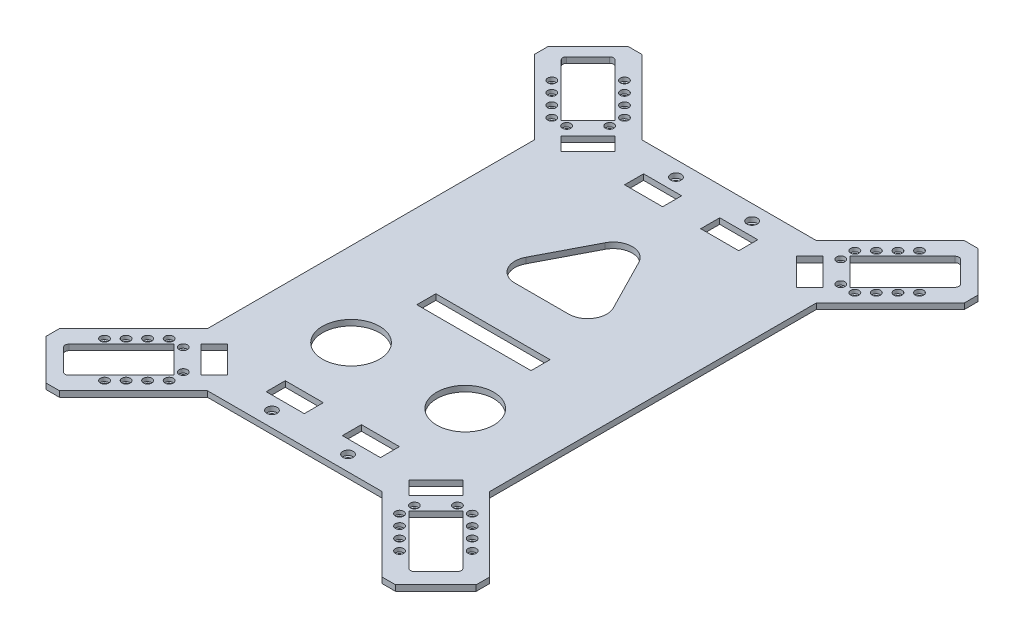
from build123d import *

# Parameters (mm, degrees)
BOSS_EXTRUDE1_DEPTH              = 3
CUT_EXTRUDE1_DEPTH               = 10
CUT_EXTRUDE2_DEPTH               = 10
CBORE_FOR_M2_SHCS1_D             = 2.4
CBORE_FOR_M2_SHCS1_CBORE_D       = 4.4
CBORE_FOR_M2_SHCS1_CBORE_DEPTH   = 2
MIRROR2_COPY_1_D                 = 2.4
MIRROR2_COPY_1_CBORE_D           = 4.4
MIRROR2_COPY_1_CBORE_DEPTH       = 2
SKETCH8_W                        = 20
SKETCH8_H                        = 10
SKETCH8_W_2                      = 60
SKETCH8_W_3                      = 120
SKETCH8_H_2                      = 75
CUT_EXTRUDE3_DEPTH               = 10
CBORE_FOR_M2_5_SHCS1_D           = 2.9
CBORE_FOR_M2_5_SHCS1_CBORE_D     = 5.5
CBORE_FOR_M2_5_SHCS1_CBORE_DEPTH = 2.5
SKETCH12_W                       = 10
SKETCH12_H                       = 20
CUT_EXTRUDE4_DEPTH               = 10
CORTAR_EXTRUIR1_DEPTH            = 64
CORTAR_EXTRUIR1_DEPTH_BACK       = 56
CROQUIS1_W                       = 127.204411498
CROQUIS1_H                       = 60
CORTAR_EXTRUIR2_DEPTH            = 160
CORTAR_EXTRUIR2_DEPTH_BACK       = 117
RECUBRIR8_START                  = -34.766907078
RECUBRIR8_OUTLINE_W              = 40.311288742
RECUBRIR8_OUTLINE_H              = 3
RECUBRIR8_DEPTH                  = 5.766907078
RECUBRIR9_DEPTH                  = 3
RECUBRIR13_DEPTH                 = 3
RECUBRIR15_DEPTH                 = 3
RECUBRIR17_DEPTH                 = 3
RECUBRIR19_DEPTH                 = 3
RECUBRIR23_DEPTH                 = 3
RECUBRIR27_DEPTH                 = 3
CORTAR_EXTRUIR7_DEPTH            = 83
CORTAR_EXTRUIR7_DEPTH_BACK       = 143
CORTAR_EXTRUIR8_DEPTH            = 119
CORTAR_EXTRUIR8_DEPTH_BACK       = 125
CROQUIS6_R                       = 15


with BuildPart() as part:
    # Sketch1 → Boss-Extrude1 (new body)
    with BuildSketch(Plane(origin=(0, 0, 0), x_dir=(1, 0, 0), z_dir=(0, 1, 0))):
        Polygon((-74.142135624, -30), (-74.142135624, -85.857864376), (-113.033008589, -124.748737342), (-113.033008589, -131.819805153), (-91.819805153, -153.033008589), (-84.748737342, -153.033008589), (-45.857864376, -114.142135624), (45.857864376, -114.142135624), (84.748737342, -153.033008589), (91.819805153, -153.033008589), (113.033008589, -131.819805153), (113.033008589, -124.748737342), (74.142135624, -85.857864376), (74.142135624, -30), (90.606601718, -20), (145.606601718, -20), (150.606601718, -15), (150.606601718, 15), (145.606601718, 20), (90.606601718, 20), (74.142135624, 30), (74.142135624, 85.857864376), (113.033008589, 124.748737342), (113.033008589, 131.819805153), (91.819805153, 153.033008589), (84.748737342, 153.033008589), (45.857864376, 114.142135624), (-45.857864376, 114.142135624), (-84.748737342, 153.033008589), (-91.819805153, 153.033008589), (-113.033008589, 131.819805153), (-113.033008589, 124.748737342), (-74.142135624, 85.857864376), (-74.142135624, 30), (-90.606601718, 20), (-145.606601718, 20), (-150.606601718, 15), (-150.606601718, -15), (-145.606601718, -20), (-90.606601718, -20), align=None)
    extrude(amount=BOSS_EXTRUDE1_DEPTH)

    # Sketch2 → Cut-Extrude1 (cut)
    with BuildSketch(Plane(origin=(0, 3, 0), x_dir=(1, 0, 0), z_dir=(0, 1, 0))):
        with BuildLine():
            Line((103.106601718, 10), (128.534564611, 10))
            Line((128.534564611, 10), (142.106601718, 10))
            ThreePointArc((142.106601718, 10), (143.52081528, 9.414213562), (144.106601718, 8))
            Line((144.106601718, 8), (144.106601718, -8))
            ThreePointArc((144.106601718, -8), (143.52081528, -9.414213562), (142.106601718, -10))
            Line((142.106601718, -10), (129.458446123, -10))
            Line((129.458446123, -10), (103.106601718, -10))
            Line((103.106601718, -10), (103.106601718, 10))
        make_face()
        with BuildLine():
            Line((-103.106601718, -10), (-129.458446123, -10))
            Line((-129.458446123, -10), (-142.106601718, -10))
            ThreePointArc((-142.106601718, -10), (-143.52081528, -9.414213562), (-144.106601718, -8))
            Line((-144.106601718, -8), (-144.106601718, 8))
            ThreePointArc((-144.106601718, 8), (-143.52081528, 9.414213562), (-142.106601718, 10))
            Line((-142.106601718, 10), (-128.534564611, 10))
            Line((-128.534564611, 10), (-103.106601718, 10))
            Line((-103.106601718, 10), (-103.106601718, -10))
        make_face()
    extrude(amount=-CUT_EXTRUDE1_DEPTH, mode=Mode.SUBTRACT)

    # Sketch4 → Cut-Extrude2 (cut)
    with BuildSketch(Plane(origin=(0, 3, 0), x_dir=(1, 0, 0), z_dir=(0, 1, 0))):
        with BuildLine():
            Line((-75.909902577, 101.767766953), (-61.767766953, 115.909902577))
            Line((-61.767766953, 115.909902577), (-80.058321582, 134.200457205))
            Line((-80.058321582, 134.200457205), (-89.344931419, 143.487067043))
            ThreePointArc((-89.344931419, 143.487067043), (-90.759144982, 144.072853481), (-92.173358544, 143.487067043))
            Line((-92.173358544, 143.487067043), (-103.487067043, 132.173358544))
            ThreePointArc((-103.487067043, 132.173358544), (-104.072853481, 130.759144982), (-103.487067043, 129.344931419))
            Line((-103.487067043, 129.344931419), (-94.200457205, 120.058321582))
            Line((-94.200457205, 120.058321582), (-75.909902577, 101.767766953))
        make_face()
        with BuildLine():
            Line((94.200457205, 120.058321582), (75.909902577, 101.767766953))
            Line((75.909902577, 101.767766953), (61.767766953, 115.909902577))
            Line((61.767766953, 115.909902577), (80.058321582, 134.200457205))
            Line((80.058321582, 134.200457205), (89.344931419, 143.487067043))
            ThreePointArc((89.344931419, 143.487067043), (90.759144982, 144.072853481), (92.173358544, 143.487067043))
            Line((92.173358544, 143.487067043), (103.487067043, 132.173358544))
            ThreePointArc((103.487067043, 132.173358544), (104.072853481, 130.759144982), (103.487067043, 129.344931419))
            Line((103.487067043, 129.344931419), (94.200457205, 120.058321582))
        make_face()
        with BuildLine():
            Line((75.909902577, -101.767766953), (61.767766953, -115.909902577))
            Line((61.767766953, -115.909902577), (80.058321582, -134.200457205))
            Line((80.058321582, -134.200457205), (87.930717857, -142.072853481))
            ThreePointArc((87.930717857, -142.072853481), (89.344931419, -142.658639918), (90.759144982, -142.072853481))
            Line((90.759144982, -142.072853481), (102.072853481, -130.759144982))
            ThreePointArc((102.072853481, -130.759144982), (102.658639918, -129.344931419), (102.072853481, -127.930717857))
            Line((102.072853481, -127.930717857), (94.200457205, -120.058321582))
            Line((94.200457205, -120.058321582), (75.909902577, -101.767766953))
        make_face()
        with BuildLine():
            Line((-94.200457205, -120.058321582), (-75.909902577, -101.767766953))
            Line((-75.909902577, -101.767766953), (-61.767766953, -115.909902577))
            Line((-61.767766953, -115.909902577), (-80.058321582, -134.200457205))
            Line((-80.058321582, -134.200457205), (-89.344931419, -143.487067043))
            ThreePointArc((-89.344931419, -143.487067043), (-90.759144982, -144.072853481), (-92.173358544, -143.487067043))
            Line((-92.173358544, -143.487067043), (-103.487067043, -132.173358544))
            ThreePointArc((-103.487067043, -132.173358544), (-104.072853481, -130.759144982), (-103.487067043, -129.344931419))
            Line((-103.487067043, -129.344931419), (-94.200457205, -120.058321582))
        make_face()
    extrude(amount=-CUT_EXTRUDE2_DEPTH, mode=Mode.SUBTRACT)

    # CBORE for M2 SHCS1 (through all)
    with Locations(Plane(origin=(0, 3, 0), x_dir=(-1, 0, 0), z_dir=(0, 1, 0))):
        with Locations((-104.856601718, -13.5), (-112.856601718, -13.5), (-120.856601718, -13.5), (-128.856601718, -13.5), (-60.530330086, -119.622213178), (-66.187184335, -125.279067427), (-71.844038585, -130.935921677), (-77.500892834, -136.592775926), (-79.622213178, -100.530330086), (-85.279067427, -106.187184335), (-90.935921677, -111.844038585), (-96.592775926, -117.500892834), (-104.856601718, 13.5), (-112.856601718, 13.5), (-120.856601718, 13.5), (-128.856601718, 13.5), (-60.707106781, -112.02081528), (-72.02081528, -100.707106781), (-99.606601718, -8), (-99.606601718, 8)):
            cbore_for_m2_shcs1 = CounterBoreHole(CBORE_FOR_M2_SHCS1_D / 2, CBORE_FOR_M2_SHCS1_CBORE_D / 2, CBORE_FOR_M2_SHCS1_CBORE_DEPTH)

    # Mirror1: CBORE for M2 SHCS1 across plane
    add(cbore_for_m2_shcs1.mirror(Plane(origin=(0, 0, 0), x_dir=(0, 0, 1), z_dir=(1, 0, 0))), mode=Mode.SUBTRACT)

    # Mirror2: CBORE for M2 SHCS1 across plane
    add(cbore_for_m2_shcs1.mirror(Plane.XY), mode=Mode.SUBTRACT)

    # Mirror2 copy 1 (through all)
    with Locations(Plane(origin=(0, 3, 0), x_dir=(1, 0, 0), z_dir=(0, 1, 0))):
        with Locations((-104.856601718, -13.5), (-112.856601718, -13.5), (-120.856601718, -13.5), (-128.856601718, -13.5), (-60.530330086, -119.622213178), (-66.187184335, -125.279067427), (-71.844038585, -130.935921677), (-77.500892834, -136.592775926), (-79.622213178, -100.530330086), (-85.279067427, -106.187184335), (-90.935921677, -111.844038585), (-96.592775926, -117.500892834), (-104.856601718, 13.5), (-112.856601718, 13.5), (-120.856601718, 13.5), (-128.856601718, 13.5), (-60.707106781, -112.02081528), (-72.02081528, -100.707106781), (-99.606601718, -8), (-99.606601718, 8)):
            CounterBoreHole(MIRROR2_COPY_1_D / 2, MIRROR2_COPY_1_CBORE_D / 2, MIRROR2_COPY_1_CBORE_DEPTH)

    # Sketch8 → Cut-Extrude3 (cut)
    with BuildSketch(Plane(origin=(0, 3, 0), x_dir=(1, 0, 0), z_dir=(0, 1, 0))):
        with Locations((20, -94.142135624)):
            Rectangle(SKETCH8_W, SKETCH8_H)
        with Locations((-20, -94.142135624)):
            Rectangle(SKETCH8_W, SKETCH8_H)
        Polygon((-20, -28.162470747), (-55, -28.162470747), (-60, -33.162470747), (-60, -78.162470747), (-55.430942257, -81.131778417), (-19.569057743, -65.193163077), (-15, -58.162470747), (-15, -33.162470747), align=None)
        with Locations((0, -15)):
            Rectangle(SKETCH8_W_2, SKETCH8_H)
        Polygon((55, -28.162470747), (20, -28.162470747), (15, -33.162470747), (15, -58.162470747), (19.569057743, -65.193163077), (55.430942257, -81.131778417), (60, -78.162470747), (60, -33.162470747), align=None)
        with Locations((0, 37.5)):
            Rectangle(SKETCH8_W_3, SKETCH8_H_2)
        with Locations((20, 94.142135624)):
            Rectangle(SKETCH8_W, SKETCH8_H)
        with Locations((-20, 94.142135624)):
            Rectangle(SKETCH8_W, SKETCH8_H)
    extrude(amount=-CUT_EXTRUDE3_DEPTH, mode=Mode.SUBTRACT)

    # CBORE for M2.5 SHCS1 (through all)
    with Locations(Plane(origin=(0, 3, 0), x_dir=(-1, 0, 0), z_dir=(0, 1, 0))):
        with Locations((20, -106.142135624), (-20, -106.142135624), (20, 106.142135624), (-20, 106.142135624)):
            CounterBoreHole(CBORE_FOR_M2_5_SHCS1_D / 2, CBORE_FOR_M2_5_SHCS1_CBORE_D / 2, CBORE_FOR_M2_5_SHCS1_CBORE_DEPTH)

    # Sketch12 → Cut-Extrude4 (cut)
    with BuildSketch(Plane(origin=(0, 3, 0), x_dir=(1, 0, 0), z_dir=(0, 1, 0))):
        Polygon((54.696699141, -108.838834765), (68.838834765, -94.696699141), (61.767766953, -87.625631329), (47.625631329, -101.767766953), align=None)
        with Locations((-88.106601718, 0)):
            Rectangle(SKETCH12_W, SKETCH12_H)
        with Locations((88.106601718, 0)):
            Rectangle(SKETCH12_W, SKETCH12_H)
        Polygon((-68.838834765, -94.696699141), (-54.696699141, -108.838834765), (-47.625631329, -101.767766953), (-61.767766953, -87.625631329), align=None)
        Polygon((-68.838834765, 94.696699141), (-54.696699141, 108.838834765), (-47.625631329, 101.767766953), (-61.767766953, 87.625631329), align=None)
        Polygon((68.838834765, 94.696699141), (54.696699141, 108.838834765), (47.625631329, 101.767766953), (61.767766953, 87.625631329), align=None)
    extrude(amount=-CUT_EXTRUDE4_DEPTH, mode=Mode.SUBTRACT)

    # Croquis1 → Cortar-Extruir1 (cut, two sides: drawn at the far end of the back side and taken through both)
    with BuildSketch(Plane(origin=(0, 3, 0), x_dir=(-1, 0, 0), z_dir=(0, 1, 0)).offset(-CORTAR_EXTRUIR1_DEPTH_BACK)):
        with Locations((137.744341373, 0)):
            Rectangle(CROQUIS1_W, CROQUIS1_H)
    extrude(amount=CORTAR_EXTRUIR1_DEPTH + CORTAR_EXTRUIR1_DEPTH_BACK, mode=Mode.SUBTRACT)

    # Croquis2 → Cortar-Extruir2 (cut, two sides: drawn at the far end of the back side and taken through both)
    with BuildSketch(Plane(origin=(0, 3, 0), x_dir=(-1, 0, 0), z_dir=(0, 1, 0)).offset(-CORTAR_EXTRUIR2_DEPTH_BACK)):
        Polygon((-74.142135624, 30), (-74.142135624, -30), (-161.977885132, -37.027880566), (-168.471156488, 44.126224275), align=None)
    extrude(amount=CORTAR_EXTRUIR2_DEPTH + CORTAR_EXTRUIR2_DEPTH_BACK, mode=Mode.SUBTRACT)

    # loft from a face of the part (recubrir1)
    loft([part.faces().sort_by_distance((-60, 1.5, -37.5))[0], part.faces().sort_by_distance((60, 1.5, -37.5))[0]])

    # loft from a face of the part (recubrir4)
    loft([part.faces().sort_by_distance((-15, 1.5, 45.662470747))[0], part.faces().sort_by_distance((-60, 1.5, 55.662470747))[0]])

    # loft from a face of the part (recubrir5)
    loft([part.faces().sort_by_distance((60, 1.5, 55.662470747))[0], part.faces().sort_by_distance((15, 1.5, 45.662470747))[0]])

    # Recubrir8: read off the stored shape, not the designer's step
    # Recubrir8 outline → Recubrir8 (add)
    with BuildSketch(Plane(origin=(0, 0, 0), x_dir=(0.9922778767136677, 0, 0.12403473458920797), z_dir=(0.12403473458920797, 0, -0.9922778767136677)).offset(RECUBRIR8_START)):
        with Locations((-30.926514264, -1.5)):
            Rectangle(RECUBRIR8_OUTLINE_W, RECUBRIR8_OUTLINE_H)
    extrude(amount=RECUBRIR8_DEPTH)

    # Recubrir9: read off the stored shape, not the designer's step
    # Recubrir9 outline → Recubrir9 (add)
    with BuildSketch(Plane(origin=(0, 0, 0), x_dir=(1, 0, 0), z_dir=(0, 1, 0))):
        Polygon((-15, -33.162470747), (-55, -28.162470747), (-60, -33.162470747), align=None)
    extrude(amount=RECUBRIR9_DEPTH)

    # Recubrir13: read off the stored shape, not the designer's step
    # Recubrir13 outline → Recubrir13 (add)
    with BuildSketch(Plane(origin=(0, 0, 0), x_dir=(1, 0, 0), z_dir=(0, 1, 0))):
        Polygon((60, -33.162470747), (55, -28.162470747), (15, -33.162470747), align=None)
    extrude(amount=RECUBRIR13_DEPTH)

    # Recubrir15: read off the stored shape, not the designer's step
    # Recubrir15 outline → Recubrir15 (add)
    with BuildSketch(Plane(origin=(0, 0, 0), x_dir=(1, 0, 0), z_dir=(0, 1, 0))):
        Polygon((55, -28.162470747), (20, -28.162470747), (15, -33.162470747), align=None)
    extrude(amount=RECUBRIR15_DEPTH)

    # Recubrir17: read off the stored shape, not the designer's step
    # Recubrir17 outline → Recubrir17 (add)
    with BuildSketch(Plane(origin=(0, 0, 0), x_dir=(1, 0, 0), z_dir=(0, 1, 0))):
        Polygon((-19.569057743, -65.193163077), (-15, -58.162470747), (-55.430942257, -81.131778417), align=None)
    extrude(amount=RECUBRIR17_DEPTH)

    # Recubrir19: read off the stored shape, not the designer's step
    # Recubrir19 outline → Recubrir19 (add)
    with BuildSketch(Plane(origin=(0, 0, 0), x_dir=(1, 0, 0), z_dir=(0, 1, 0))):
        Polygon((-15, -58.162470747), (-60, -78.162470747), (-55.430942257, -81.131778417), align=None)
    extrude(amount=RECUBRIR19_DEPTH)

    # Recubrir23: read off the stored shape, not the designer's step
    # Recubrir23 outline → Recubrir23 (add)
    with BuildSketch(Plane(origin=(0, 0, 0), x_dir=(1, 0, 0), z_dir=(0, 1, 0))):
        Polygon((60, -78.162470747), (19.569057743, -65.193163077), (55.430942257, -81.131778417), align=None)
    extrude(amount=RECUBRIR23_DEPTH)

    # Recubrir27: read off the stored shape, not the designer's step
    # Recubrir27 outline → Recubrir27 (add)
    with BuildSketch(Plane(origin=(0, 0, 0), x_dir=(1, 0, 0), z_dir=(0, 1, 0))):
        Polygon((60, -78.162470747), (15, -58.162470747), (19.569057743, -65.193163077), align=None)
    extrude(amount=RECUBRIR27_DEPTH)

    # Croquis5 → Cortar-Extruir7 (cut, two sides: drawn at the far end of the back side and taken through both)
    with BuildSketch(Plane(origin=(0, 3, 0), x_dir=(-1, 0, 0), z_dir=(0, 1, 0)).offset(-CORTAR_EXTRUIR7_DEPTH_BACK)):
        with BuildLine():
            Line((8.741292884, -57.664556646), (22.981381474, -30.219872669))
            ThreePointArc((22.981381474, -30.219872669), (22.650734604, -20.420817348), (14.105093625, -15.614276721))
            Line((14.105093625, -15.614276721), (-14.169022066, -15.614276721))
            ThreePointArc((-14.169022066, -15.614276721), (-22.699217037, -20.395486272), (-23.072482075, -30.167121971))
            Line((-23.072482075, -30.167121971), (-9.038454974, -57.611805948))
            ThreePointArc((-9.038454974, -57.611805948), (-0.164663814, -63.058916686), (8.741292884, -57.664556646))
        make_face()
    extrude(amount=CORTAR_EXTRUIR7_DEPTH + CORTAR_EXTRUIR7_DEPTH_BACK, mode=Mode.SUBTRACT)

    # Croquis6 → Cortar-Extruir8 (cut, two sides: drawn at the far end of the back side and taken through both)
    with BuildSketch(Plane(origin=(0, 3, 0), x_dir=(-1, 0, 0), z_dir=(0, 1, 0)).offset(-CORTAR_EXTRUIR8_DEPTH_BACK)):
        with Locations(Location((-30, 54.571067812, 0), (0, 0, 270))):
            Circle(CROQUIS6_R)
        with Locations(Location((30, 54.571067812, 0), (0, 0, 270))):
            Circle(CROQUIS6_R)
    extrude(amount=CORTAR_EXTRUIR8_DEPTH + CORTAR_EXTRUIR8_DEPTH_BACK, mode=Mode.SUBTRACT)


solid = part.part
